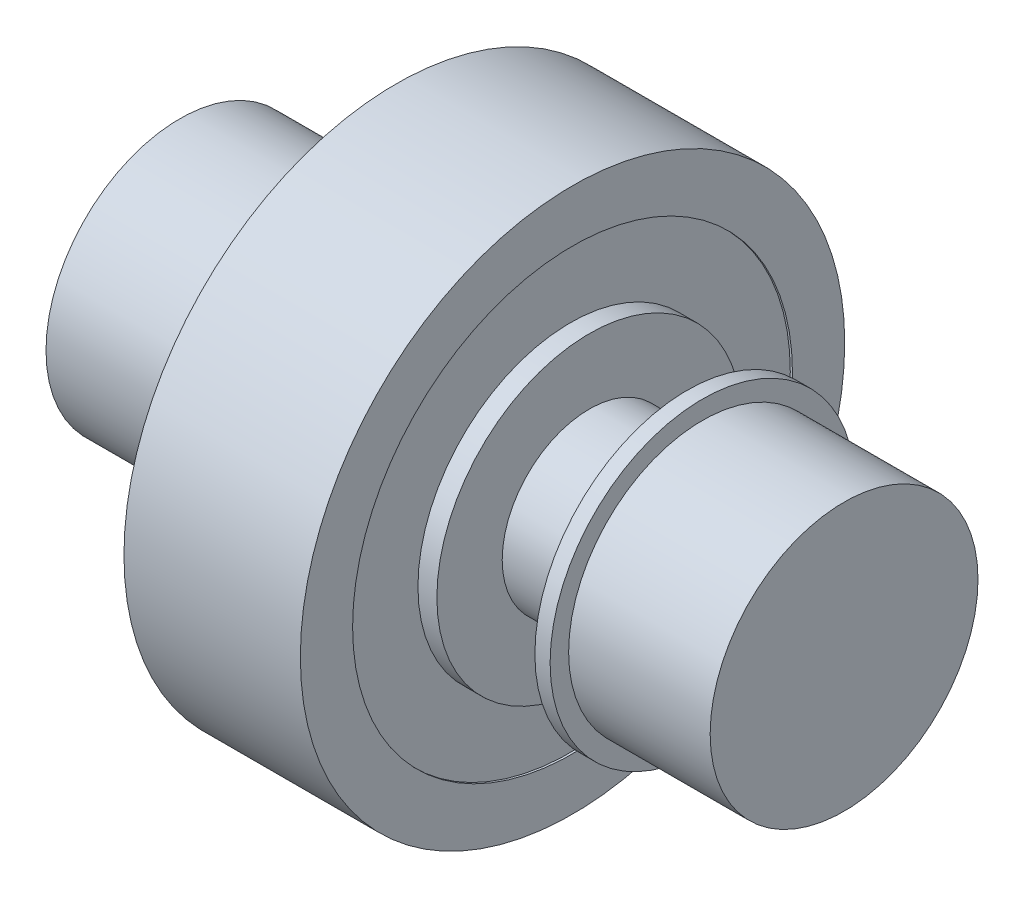
from build123d import *


with BuildPart() as part:
    # Schizzo1 → Rivoluzione1 (revolve)
    with BuildSketch(Plane.XY):
        Polygon((-152.5, 0), (152.5, 0), (152.5, 61.5), (87.5, 61.5), (87.5, 70), (80.5, 70), (80.5, 40), (35.5, 40), (35.5, 70), (26.8, 70), (26.8, 101), (-44.5, 101), (-44.5, 61.5), (-152.5, 61.5), align=None)
    revolve(axis=Axis((-1716.324322208, 0, 0), (1, 0, 0)))

    # Schizzo4 → Rivoluzione2 (revolve)
    with BuildSketch(Plane.XY):
        Polygon((-44.5, 0), (-44.5, 101), (-53.2, 101), (-53.2, 125), (27.8, 125), (27.8, 101), (26.8, 101), (26.8, 0), align=None)
    revolve(axis=Axis((152.5, 0, 0), (-1, 0, 0)))


solid = part.part
